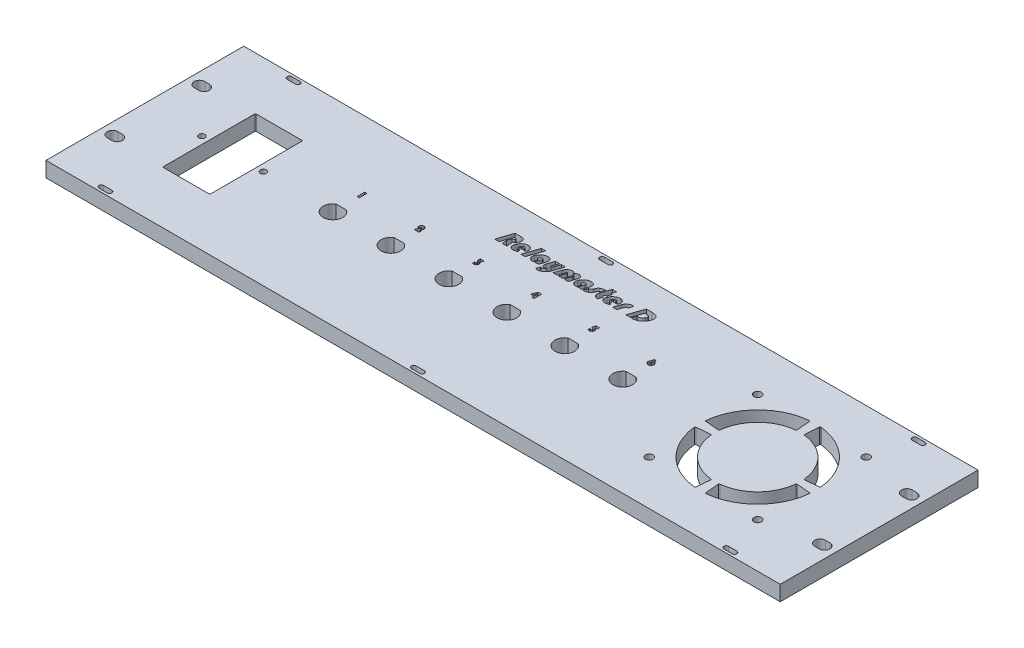
from build123d import *

# Parameters (mm, degrees)
SKETCH1_W           = 482.6
SKETCH1_H           = 130
BOSS_EXTRUDE1_DEPTH = 10
CUT_EXTRUDE2_DEPTH  = 407.159250458
SKETCH3_R           = 2
SKETCH3_W           = 31
SKETCH3_H           = 61
CUT_EXTRUDE3_DEPTH  = 407.159250576
FILLET1_R           = 0.5
SKETCH4_R           = 2.5
CUT_EXTRUDE4_DEPTH  = 407.159250576
FILLET2_R           = 0.5
CUT_EXTRUDE5_DEPTH  = 10
LPATTERN1_COUNT     = 6
LPATTERN1_PITCH     = 38.1
SKETCH6_W           = 1.458333334
SKETCH6_H           = 5
CUT_EXTRUDE6_DEPTH  = 407.159250576
CUT_EXTRUDE7_DEPTH  = 407.159250576
LPATTERN2_COUNT     = 2
LPATTERN2_PITCH     = 205.4
LPATTERN3_COUNT     = 2
LPATTERN3_PITCH     = 205.4


with BuildPart() as part:
    # Sketch1 → Boss-Extrude1 (new body)
    with BuildSketch(Plane(origin=(0, 0, 0), x_dir=(1, 0, 0), z_dir=(0, 1, 0))):
        with Locations((158.999180011, 3.013992786)):
            Rectangle(SKETCH1_W, SKETCH1_H)
        with BuildLine():
            Line((-75.000819989, 35.088992786), (-72.000819989, 35.088992786))
            ThreePointArc((-72.000819989, 35.088992786), (-68.500819989, 31.588992786), (-72.000819989, 28.088992786))
            Line((-72.000819989, 28.088992786), (-75.000819989, 28.088992786))
            ThreePointArc((-75.000819989, 28.088992786), (-78.500819989, 31.588992786), (-75.000819989, 35.088992786))
        make_face(mode=Mode.SUBTRACT)
        with BuildLine():
            Line((-75.000819989, -22.061007214), (-72.000819989, -22.061007214))
            ThreePointArc((-72.000819989, -22.061007214), (-68.500819989, -25.561007214), (-72.000819989, -29.061007214))
            Line((-72.000819989, -29.061007214), (-75.000819989, -29.061007214))
            ThreePointArc((-75.000819989, -29.061007214), (-78.500819989, -25.561007214), (-75.000819989, -22.061007214))
        make_face(mode=Mode.SUBTRACT)
        with BuildLine():
            Line((392.999180011, 28.088992786), (389.999180011, 28.088992786))
            ThreePointArc((389.999180011, 28.088992786), (386.499180011, 31.588992786), (389.999180011, 35.088992786))
            Line((389.999180011, 35.088992786), (392.999180011, 35.088992786))
            ThreePointArc((392.999180011, 35.088992786), (396.499180011, 31.588992786), (392.999180011, 28.088992786))
        make_face(mode=Mode.SUBTRACT)
        with BuildLine():
            Line((392.999180011, -29.061007214), (389.999180011, -29.061007214))
            ThreePointArc((389.999180011, -29.061007214), (386.499180011, -25.561007214), (389.999180011, -22.061007214))
            Line((389.999180011, -22.061007214), (392.999180011, -22.061007214))
            ThreePointArc((392.999180011, -22.061007214), (396.499180011, -25.561007214), (392.999180011, -29.061007214))
        make_face(mode=Mode.SUBTRACT)
    extrude(amount=BOSS_EXTRUDE1_DEPTH)

    # Sketch2 → Cut-Extrude2 (cut, through all)
    with BuildSketch(Plane(origin=(0, 10, 0), x_dir=(1, 0, 0), z_dir=(0, 1, 0))):
        with BuildLine():
            Line((115.335548963, 47.892597993), (112.88112188, 40.670375771))
            Line((112.88112188, 40.670375771), (109.964455213, 40.670375771))
            Line((109.964455213, 40.670375771), (113.362892713, 50.670375771))
            Line((113.362892713, 50.670375771), (117.238760769, 50.670375771))
            add(Edge.make_bspline(
                [(117.238760769, 50.670375771), (117.378488132, 50.66829828), (117.647033186, 50.664305505), (118.032383194, 50.622395907), (118.384034766, 50.556106218), (118.703397593, 50.463941844), (118.989470951, 50.342718773), (119.24243641, 50.19399272), (119.463573048, 50.018796041), (119.582453092, 49.878197324), (119.641104519, 49.808830632)],
                knots=[0, 0, 0, 0, 1.268946959, 2.438816719, 3.516291673, 4.516504795, 5.452755853, 6.33073326, 7.176439771, 8, 8, 8, 8], degree=3))
            add(Edge.make_bspline(
                [(119.641104519, 49.808830632), (119.699587482, 49.728059333), (119.815497833, 49.567974599), (119.940169757, 49.297913336), (120.030331769, 49.014477201), (120.080789399, 48.714181217), (120.087163726, 48.398352863), (120.058501635, 48.067327276), (119.990585038, 47.719606274), (119.917613523, 47.487590833), (119.879819797, 47.367424382)],
                knots=[0, 0, 0, 0, 0.932249006, 1.847671586, 2.771408984, 3.712800187, 4.689011787, 5.722820456, 6.820593216, 8, 8, 8, 8], degree=3))
            add(Edge.make_bspline(
                [(119.879819797, 47.367424382), (119.833154617, 47.242640155), (119.73998991, 46.993514658), (119.553958798, 46.637392928), (119.334324356, 46.296255789), (119.079127949, 45.968930566), (118.78594183, 45.657949303), (118.458228568, 45.360912296), (118.093564888, 45.0791406), (117.831047228, 44.908966444), (117.696660074, 44.821851465)],
                knots=[0, 0, 0, 0, 0.933827764, 1.864340643, 2.811651759, 3.77699005, 4.771445029, 5.806065946, 6.876888697, 8, 8, 8, 8], degree=3))
            Line((117.696660074, 44.821851465), (118.000479519, 40.670375771))
            Line((118.000479519, 40.670375771), (114.879819797, 40.670375771))
            Line((114.879819797, 40.670375771), (114.539107991, 43.91473341))
            Line((114.539107991, 43.91473341), (115.42018438, 46.503709104))
            Line((115.42018438, 46.503709104), (115.65455938, 46.503709104))
            add(Edge.make_bspline(
                [(115.65455938, 46.503709104), (115.734971548, 46.505495396), (115.889388907, 46.508925654), (116.109255254, 46.54293042), (116.305300414, 46.602372599), (116.479184767, 46.681114562), (116.62723646, 46.787460897), (116.750966962, 46.916259013), (116.85384571, 47.067291832), (116.897440132, 47.182563833), (116.919750352, 47.241556327)],
                knots=[0, 0, 0, 0, 1.223524833, 2.349563247, 3.373699419, 4.334298088, 5.241868773, 6.129650763, 7.042815567, 8, 8, 8, 8], degree=3))
            add(Edge.make_bspline(
                [(116.919750352, 47.241556327), (116.934777382, 47.291682787), (116.96261298, 47.384535466), (116.951585407, 47.524880574), (116.89732647, 47.646143738), (116.792814469, 47.740167427), (116.648948346, 47.811035287), (116.462837151, 47.857858322), (116.235649041, 47.887282053), (116.069892532, 47.890729859), (115.980080213, 47.892597993)],
                knots=[0, 0, 0, 0, 0.898624187, 1.664583208, 2.38131814, 3.142559736, 4.043707542, 5.133639638, 6.446911837, 8, 8, 8, 8], degree=3))
            Line((115.980080213, 47.892597993), (115.335548963, 47.892597993))
        make_face()
        with BuildLine():
            Line((127.08034063, 43.864820215), (122.928864935, 43.864820215))
            add(Edge.make_bspline(
                [(122.928864935, 43.864820215), (122.941416881, 43.962312226), (122.965754006, 44.151340708), (123.019854456, 44.334063129), (123.046052435, 44.42254591)],
                knots=[0, 0, 0, 0, 1.031506037, 2, 2, 2, 2], degree=3))
            add(Edge.make_bspline(
                [(123.046052435, 44.42254591), (123.090855315, 44.540828871), (123.182631693, 44.783125392), (123.320526452, 45.002525583), (123.391104519, 45.114820215)],
                knots=[0, 0, 0, 0, 0.976348819, 2, 2, 2, 2], degree=3))
            Line((123.391104519, 45.114820215), (124.782163547, 45.114820215))
            add(Edge.make_bspline(
                [(124.782163547, 45.114820215), (124.794125549, 45.190555028), (124.816364301, 45.331354834), (124.820854111, 45.531171801), (124.793971278, 45.701662984), (124.738371102, 45.844500806), (124.64770514, 45.956620204), (124.524334681, 46.034533211), (124.372169651, 46.079911288), (124.261662272, 46.084562352), (124.202736463, 46.087042438)],
                knots=[0, 0, 0, 0, 1.359693728, 2.52782843, 3.530177573, 4.404996503, 5.216909677, 6.042905647, 6.95641929, 8, 8, 8, 8], degree=3))
            add(Edge.make_bspline(
                [(124.202736463, 46.087042438), (124.118193946, 46.08130003), (123.946617115, 46.069645964), (123.694243041, 45.98197496), (123.450590766, 45.837939098), (123.215080686, 45.646292226), (122.997634436, 45.410280729), (122.806729307, 45.138945992), (122.641283655, 44.838221078), (122.560133535, 44.620494666), (122.518708685, 44.509351465)],
                knots=[0, 0, 0, 0, 0.827832751, 1.680064964, 2.58876647, 3.592266134, 4.646151931, 5.724523089, 6.838433137, 8, 8, 8, 8], degree=3))
            add(Edge.make_bspline(
                [(122.518708685, 44.509351465), (122.483339164, 44.39509878), (122.417212985, 44.18149415), (122.365590101, 43.868754192), (122.368927442, 43.589813158), (122.409068136, 43.379255472), (122.472460702, 43.236894832), (122.526284729, 43.143326768), (122.593203099, 43.065165826), (122.672675932, 43.002459843), (122.76097664, 42.95240462), (122.861064326, 42.91800648), (122.970519006, 42.895296046), (123.047374853, 42.893520178), (123.087285074, 42.892597993)],
                knots=[0, 0, 0, 0, 2.100659137, 3.927352035, 5.54202328, 6.985703129, 7.651739151, 8.273086743, 8.877024698, 9.446816915, 10.044433555, 10.651574031, 11.299780288, 12, 12, 12, 12], degree=3))
            add(Edge.make_bspline(
                [(123.087285074, 42.892597993), (123.157992575, 42.896846389), (123.305307183, 42.905697653), (123.527147225, 42.981170691), (123.761975886, 43.088670137), (123.912576788, 43.190369443), (123.992232991, 43.244160493)],
                knots=[0, 0, 0, 0, 0.859384503, 1.790473304, 2.831331656, 4, 4, 4, 4], degree=3))
            Line((123.992232991, 43.244160493), (124.918882297, 41.377841049))
            add(Edge.make_bspline(
                [(124.918882297, 41.377841049), (124.805303666, 41.310728523), (124.581406324, 41.178429727), (124.239470938, 41.005695243), (123.899490712, 40.858075685), (123.55930414, 40.741558557), (123.221125601, 40.647379427), (122.884034174, 40.579476505), (122.548630924, 40.539259758), (122.325670825, 40.534066996), (122.214889241, 40.531486882)],
                knots=[0, 0, 0, 0, 1.103083133, 2.174505721, 3.201645937, 4.200367129, 5.179341595, 6.135640026, 7.073660477, 8, 8, 8, 8], degree=3))
            add(Edge.make_bspline(
                [(122.214889241, 40.531486882), (122.08447934, 40.534542961), (121.831239059, 40.540477496), (121.46563732, 40.594130465), (121.126911628, 40.67645059), (120.81666703, 40.797954249), (120.532881795, 40.951084527), (120.278020994, 41.142371642), (120.053394583, 41.368839763), (119.856039792, 41.623968412), (119.693107858, 41.905425347), (119.571628364, 42.207548617), (119.487556662, 42.524586226), (119.448505815, 42.858099669), (119.442540147, 43.207624328), (119.485056147, 43.573147197), (119.562475159, 43.95478481), (119.643015599, 44.209077619), (119.684507297, 44.340080632)],
                knots=[0, 0, 0, 0, 1.131220035, 2.196692713, 3.200169955, 4.150382372, 5.080363814, 5.990725719, 6.905256434, 7.84081604, 8.783092785, 9.718125583, 10.65923029, 11.620967352, 12.625583103, 13.686384095, 14.808103719, 16, 16, 16, 16], degree=3))
            add(Edge.make_bspline(
                [(119.684507297, 44.340080632), (119.733155835, 44.472535163), (119.830125559, 44.736552946), (120.010903896, 45.11782135), (120.22536001, 45.480668303), (120.466831402, 45.828883941), (120.736861267, 46.162351996), (121.037639597, 46.479617852), (121.367860315, 46.781926048), (121.725988902, 47.062963718), (122.098942762, 47.320761063), (122.480157748, 47.54881461), (122.866600262, 47.739415146), (123.257139225, 47.897666728), (123.652283458, 48.019047922), (124.051420184, 48.106259338), (124.454426572, 48.160406735), (124.724851489, 48.167049081), (124.860288547, 48.170375771)],
                knots=[0, 0, 0, 0, 0.990392726, 1.974121168, 2.95757423, 3.946624651, 4.946878979, 5.967240611, 7.013379789, 8.087405977, 9.160939677, 10.194875671, 11.203387311, 12.183319209, 13.150466102, 14.101868051, 15.049357545, 16, 16, 16, 16], degree=3))
            add(Edge.make_bspline(
                [(124.860288547, 48.170375771), (124.989195588, 48.167003668), (125.23862877, 48.1604787), (125.599393998, 48.111487389), (125.931153197, 48.024075122), (126.236694853, 47.904867463), (126.513843985, 47.74969987), (126.765368016, 47.561719056), (126.985108142, 47.335554054), (127.175112098, 47.079561889), (127.334231451, 46.800275749), (127.453722842, 46.500766121), (127.535740598, 46.185138669), (127.572343683, 45.85303417), (127.575816123, 45.505771847), (127.533222764, 45.144147586), (127.458770539, 44.765643518), (127.378112369, 44.513715051), (127.336417019, 44.38348341)],
                knots=[0, 0, 0, 0, 1.131233226, 2.188919233, 3.186797597, 4.135858022, 5.059607904, 5.966224945, 6.882086875, 7.816638679, 8.757680654, 9.694945741, 10.638874518, 11.610640238, 12.620124796, 13.680208972, 14.800809634, 16, 16, 16, 16], degree=3))
            add(Edge.make_bspline(
                [(127.336417019, 44.38348341), (127.324471304, 44.352230352), (127.297152142, 44.280756408), (127.241258667, 44.163046447), (127.168061661, 44.021253826), (127.111065975, 43.919612967), (127.08034063, 43.864820215)],
                knots=[0, 0, 0, 0, 0.693176941, 1.585255743, 2.698254966, 4, 4, 4, 4], degree=3))
        make_face()
        Polygon((133.362892713, 50.670375771), (129.964455213, 40.670375771), (127.186677435, 40.670375771), (130.585114935, 50.670375771), align=None)
        with BuildLine():
            Line((136.457510769, 43.430792438), (135.487458685, 40.577059799))
            add(Edge.make_bspline(
                [(135.487458685, 40.577059799), (135.376921787, 40.563499792), (135.168596739, 40.537943718), (134.95877789, 40.533549525), (134.860288547, 40.531486882)],
                knots=[0, 0, 0, 0, 1.061196419, 2, 2, 2, 2], degree=3))
            add(Edge.make_bspline(
                [(134.860288547, 40.531486882), (134.727764931, 40.534833429), (134.471845778, 40.541296016), (134.101775461, 40.59043496), (133.761323697, 40.677711477), (133.448353472, 40.796934777), (133.162950569, 40.949536686), (132.906481501, 41.137322021), (132.68075858, 41.361871633), (132.486848438, 41.617307619), (132.325384425, 41.897723493), (132.203294986, 42.198508148), (132.122557852, 42.517663341), (132.08223896, 42.85300907), (132.080233177, 43.205447238), (132.121122706, 43.574076506), (132.201941594, 43.959771473), (132.283472842, 44.217743734), (132.325566324, 44.350931327)],
                knots=[0, 0, 0, 0, 1.144190407, 2.209570271, 3.21553817, 4.172569541, 5.094845463, 6.001870815, 6.907346212, 7.834348322, 8.763305581, 9.693584961, 10.628341389, 11.597586927, 12.603283284, 13.664902594, 14.794420756, 16, 16, 16, 16], degree=3))
            add(Edge.make_bspline(
                [(132.325566324, 44.350931327), (132.37398375, 44.482791321), (132.470273648, 44.745027187), (132.654095009, 45.121634423), (132.860458487, 45.486133354), (133.104678391, 45.831029956), (133.372661197, 46.163933582), (133.672890571, 46.479601096), (134.000019509, 46.78209882), (134.355989664, 47.062159765), (134.724998964, 47.321477753), (135.103475542, 47.548076548), (135.485817158, 47.739555998), (135.870951496, 47.896735612), (136.258486598, 48.019127059), (136.649023989, 48.106214447), (137.043366341, 48.160414346), (137.308035459, 48.167051724), (137.440583685, 48.170375771)],
                knots=[0, 0, 0, 0, 0.994917965, 1.97863784, 2.96618437, 3.960322707, 4.96997828, 5.992682734, 7.044876782, 8.124977746, 9.200176396, 10.239426291, 11.248235466, 12.227872304, 13.184528156, 14.124848425, 15.060910407, 16, 16, 16, 16], degree=3))
            add(Edge.make_bspline(
                [(137.440583685, 48.170375771), (137.583201753, 48.166841028), (137.857710374, 48.160037421), (138.252190324, 48.114078302), (138.61101029, 48.030477682), (138.937581704, 47.919787908), (139.2291217, 47.771177748), (139.485433798, 47.589607564), (139.709095397, 47.376806567), (139.892569309, 47.129765156), (140.042783005, 46.856699712), (140.147755803, 46.556447872), (140.216240252, 46.233436114), (140.240039977, 45.886931288), (140.225765332, 45.516894321), (140.172703802, 45.123891923), (140.078360059, 44.706527517), (139.987729028, 44.425502898), (139.940583685, 44.279316743)],
                knots=[0, 0, 0, 0, 1.196225853, 2.302473407, 3.323857472, 4.281343462, 5.187635444, 6.057979036, 6.907605345, 7.765509949, 8.628868004, 9.511642107, 10.423138458, 11.390568647, 12.416573448, 13.524350622, 14.712192315, 16, 16, 16, 16], degree=3))
            Line((139.940583685, 44.279316743), (138.714455213, 40.670375771))
            Line((138.714455213, 40.670375771), (135.936677435, 40.670375771))
            Line((135.936677435, 40.670375771), (137.095531602, 44.081834104))
            add(Edge.make_bspline(
                [(137.095531602, 44.081834104), (137.125372293, 44.175865751), (137.181071117, 44.35137952), (137.214182532, 44.608869329), (137.207476549, 44.837386602), (137.151188997, 45.034553405), (137.053506738, 45.19883364), (136.905887845, 45.31340088), (136.720887111, 45.38377354), (136.584807751, 45.389515743), (136.511764241, 45.392597993)],
                knots=[0, 0, 0, 0, 1.35465714, 2.52852086, 3.55473976, 4.477449583, 5.322396048, 6.136784919, 6.999879412, 8, 8, 8, 8], degree=3))
            add(Edge.make_bspline(
                [(136.511764241, 45.392597993), (136.440487272, 45.388725027), (136.295587453, 45.380851627), (136.080580816, 45.318593165), (135.867494597, 45.218862424), (135.662406979, 45.083372712), (135.471171907, 44.925914153), (135.313760861, 44.743956051), (135.183406645, 44.551882685), (135.128343188, 44.410058863), (135.101173963, 44.340080632)],
                knots=[0, 0, 0, 0, 0.917738553, 1.865681891, 2.862849718, 3.941460506, 5.026822724, 6.04444962, 7.03509894, 8, 8, 8, 8], degree=3))
            add(Edge.make_bspline(
                [(135.101173963, 44.340080632), (135.079429116, 44.269090589), (135.038522158, 44.135542317), (135.024703801, 43.936360387), (135.051527715, 43.755223054), (135.1245927, 43.597450478), (135.233579928, 43.464897699), (135.382697934, 43.375394635), (135.558300582, 43.316048654), (135.686559564, 43.311611255), (135.754385769, 43.30926466)],
                knots=[0, 0, 0, 0, 1.198022138, 2.253749655, 3.202377793, 4.129386931, 5.034563436, 5.934046712, 6.907477906, 8, 8, 8, 8], degree=3))
            add(Edge.make_bspline(
                [(135.754385769, 43.30926466), (135.873139025, 43.314497292), (136.112669262, 43.325051729), (136.34191798, 43.395347565), (136.457510769, 43.430792438)],
                knots=[0, 0, 0, 0, 0.991551279, 2, 2, 2, 2], degree=3))
        make_face()
        with BuildLine():
            Line((140.148917019, 37.532354938), (140.943187852, 39.869594521))
            add(Edge.make_bspline(
                [(140.943187852, 39.869594521), (141.02013581, 39.842699809), (141.169370442, 39.790539589), (141.393812069, 39.740560627), (141.607549569, 39.704647105), (141.747447398, 39.700280348), (141.815583685, 39.698153549)],
                knots=[0, 0, 0, 0, 1.094028368, 2.121783671, 3.0852275, 4, 4, 4, 4], degree=3))
            add(Edge.make_bspline(
                [(141.815583685, 39.698153549), (141.920143567, 39.701998741), (142.127157041, 39.709611665), (142.429761674, 39.780573707), (142.719904479, 39.891426296), (142.995136374, 40.05065303), (143.257970651, 40.253214536), (143.507164917, 40.499965332), (143.743703696, 40.791081659), (143.881619475, 41.008807831), (143.953170491, 41.12176466)],
                knots=[0, 0, 0, 0, 0.930598492, 1.842450686, 2.754758579, 3.690345955, 4.665181319, 5.704602894, 6.809142816, 8, 8, 8, 8], degree=3))
            add(Edge.make_bspline(
                [(143.953170491, 41.12176466), (143.814112857, 41.052953927), (143.549029445, 40.921781094), (143.149545971, 40.780536939), (142.77318422, 40.688423973), (142.527854899, 40.676225717), (142.410201741, 40.670375771)],
                knots=[0, 0, 0, 0, 1.146861305, 2.186243914, 3.130172742, 4, 4, 4, 4], degree=3))
            add(Edge.make_bspline(
                [(142.410201741, 40.670375771), (142.329806588, 40.673164719), (142.174025868, 40.678568831), (141.949637435, 40.711762823), (141.744805675, 40.773690165), (141.558672071, 40.858078556), (141.391462409, 40.967651362), (141.24461619, 41.102536624), (141.115161623, 41.259401746), (141.009579397, 41.44109676), (140.925549319, 41.640319772), (140.864200726, 41.854397294), (140.829559963, 42.08191437), (140.82295701, 42.321956916), (140.835065705, 42.574839567), (140.875593047, 42.840513324), (140.941108838, 43.11890367), (141.001173336, 43.306031987), (141.032163547, 43.402580632)],
                knots=[0, 0, 0, 0, 1.042971701, 2.020953713, 2.9322108, 3.809657486, 4.663202133, 5.513336514, 6.386710566, 7.291034154, 8.228574651, 9.184847823, 10.172102137, 11.204853161, 12.29467164, 13.451721446, 14.685218539, 16, 16, 16, 16], degree=3))
            Line((141.032163547, 43.402580632), (142.605514241, 48.031486882))
            Line((142.605514241, 48.031486882), (145.383292019, 48.031486882))
            Line((145.383292019, 48.031486882), (144.037805908, 44.073153549))
            add(Edge.make_bspline(
                [(144.037805908, 44.073153549), (144.023085095, 44.024955171), (143.995715082, 43.935341218), (143.971946886, 43.807975703), (143.971885102, 43.697374384), (143.997284272, 43.606051013), (144.045805577, 43.532456913), (144.118994198, 43.481030376), (144.214745234, 43.454216082), (144.284316705, 43.450287029), (144.322094102, 43.448153549)],
                knots=[0, 0, 0, 0, 1.413078495, 2.627299044, 3.621746679, 4.488562546, 5.2483103, 6.047925692, 6.940021184, 8, 8, 8, 8], degree=3))
            add(Edge.make_bspline(
                [(144.322094102, 43.448153549), (144.360668855, 43.450185893), (144.437069265, 43.454211114), (144.547256367, 43.488141488), (144.649092369, 43.543444552), (144.741541776, 43.621917787), (144.825589764, 43.720977848), (144.905177991, 43.839562972), (144.973493018, 43.982022227), (145.011654827, 44.085823883), (145.031729519, 44.140427854)],
                knots=[0, 0, 0, 0, 0.869551351, 1.722216603, 2.577381428, 3.470395431, 4.443063541, 5.50314562, 6.686551159, 8, 8, 8, 8], degree=3))
            Line((145.031729519, 44.140427854), (146.355514241, 48.031486882))
            Line((146.355514241, 48.031486882), (149.133292019, 48.031486882))
            Line((149.133292019, 48.031486882), (146.900219102, 41.460306327))
            add(Edge.make_bspline(
                [(146.900219102, 41.460306327), (146.846529409, 41.311936515), (146.740386668, 41.018614318), (146.547795979, 40.597051292), (146.333065007, 40.196534284), (146.093825937, 39.817893627), (145.830621309, 39.461002214), (145.54326396, 39.125383146), (145.230975839, 38.812174936), (145.005642705, 38.621653727), (144.89284063, 38.526278549)],
                knots=[0, 0, 0, 0, 1.050650266, 2.077100728, 3.083876355, 4.075771418, 5.057798155, 6.035120644, 7.016378708, 8, 8, 8, 8], degree=3))
            add(Edge.make_bspline(
                [(144.89284063, 38.526278549), (144.756023408, 38.420985437), (144.487833728, 38.214589449), (144.070813609, 37.94257526), (143.650947944, 37.714229619), (143.230002064, 37.525099336), (142.80635298, 37.379740057), (142.381812032, 37.274214479), (141.954882562, 37.211762244), (141.669658829, 37.202691726), (141.526955213, 37.198153549)],
                knots=[0, 0, 0, 0, 1.122840013, 2.200995601, 3.234956063, 4.229293297, 5.199609475, 6.14466215, 7.071734257, 8, 8, 8, 8], degree=3))
            add(Edge.make_bspline(
                [(141.526955213, 37.198153549), (141.404412037, 37.202354085), (141.162029915, 37.210662461), (140.807283842, 37.27584816), (140.46643697, 37.378300971), (140.254799821, 37.480982841), (140.148917019, 37.532354938)],
                knots=[0, 0, 0, 0, 1.026692551, 2.030728491, 3.014766614, 4, 4, 4, 4], degree=3))
        make_face()
        with BuildLine():
            Line((158.297788547, 40.670375771), (155.520010769, 40.670375771))
            Line((155.520010769, 40.670375771), (156.869837158, 44.643900077))
            add(Edge.make_bspline(
                [(156.869837158, 44.643900077), (156.890752793, 44.708769434), (156.928568197, 44.826053033), (156.971008238, 44.988029589), (156.986266286, 45.118552681), (156.987100273, 45.221531964), (156.957608846, 45.301254065), (156.900486246, 45.358409996), (156.816409596, 45.387340907), (156.754284388, 45.390731943), (156.720097574, 45.392597993)],
                knots=[0, 0, 0, 0, 1.748842243, 3.161901443, 4.282714784, 5.118485949, 5.776578054, 6.406334469, 7.123023523, 8, 8, 8, 8], degree=3))
            add(Edge.make_bspline(
                [(156.720097574, 45.392597993), (156.68500871, 45.390869356), (156.614263068, 45.387384103), (156.513404847, 45.347036512), (156.417609843, 45.287734638), (156.330460985, 45.201368133), (156.245513054, 45.095059054), (156.168010544, 44.963119272), (156.096691639, 44.807830463), (156.055887586, 44.694882144), (156.034333685, 44.635219521)],
                knots=[0, 0, 0, 0, 0.76938146, 1.551215389, 2.360681049, 3.240269051, 4.238683293, 5.354204105, 6.602412819, 8, 8, 8, 8], degree=3))
            Line((156.034333685, 44.635219521), (154.686677435, 40.670375771))
            Line((154.686677435, 40.670375771), (151.908899658, 40.670375771))
            Line((151.908899658, 40.670375771), (153.258726047, 44.643900077))
            add(Edge.make_bspline(
                [(153.258726047, 44.643900077), (153.2796784, 44.708765445), (153.317560192, 44.826041834), (153.359602428, 44.988061599), (153.375928708, 45.11850903), (153.374078302, 45.22209764), (153.341830196, 45.300753889), (153.284744356, 45.35912794), (153.199274759, 45.386897435), (153.136596371, 45.390588618), (153.102476047, 45.392597993)],
                knots=[0, 0, 0, 0, 1.743312146, 3.151903045, 4.269172209, 5.103326437, 5.766340049, 6.394105081, 7.125796652, 8, 8, 8, 8], degree=3))
            add(Edge.make_bspline(
                [(153.102476047, 45.392597993), (153.068092396, 45.39088703), (152.998714867, 45.387434738), (152.899603438, 45.346471978), (152.804405201, 45.287722273), (152.717069853, 45.202007064), (152.634718732, 45.094249043), (152.556727428, 44.963253216), (152.485631828, 44.807790515), (152.444794207, 44.694868336), (152.423222574, 44.635219521)],
                knots=[0, 0, 0, 0, 0.757373858, 1.528189294, 2.341787876, 3.225866826, 4.219478986, 5.340695358, 6.595277101, 8, 8, 8, 8], degree=3))
            Line((152.423222574, 44.635219521), (151.075566324, 40.670375771))
            Line((151.075566324, 40.670375771), (148.297788547, 40.670375771))
            Line((148.297788547, 40.670375771), (149.838587158, 45.20379591))
            add(Edge.make_bspline(
                [(149.838587158, 45.20379591), (149.876187575, 45.305660073), (149.950891659, 45.508042644), (150.08881248, 45.800892687), (150.250104723, 46.081138394), (150.432530847, 46.349943218), (150.635346567, 46.608295007), (150.862133246, 46.853028773), (151.10927862, 47.088165482), (151.377168463, 47.306223136), (151.653295203, 47.510151264), (151.937658229, 47.685370439), (152.223356779, 47.834364279), (152.510134361, 47.955741882), (152.79829978, 48.05362416), (153.089356707, 48.119310981), (153.381793623, 48.163528461), (153.577576306, 48.168094499), (153.675392713, 48.170375771)],
                knots=[0, 0, 0, 0, 1.013103043, 2.012821709, 3.016908165, 4.028119661, 5.042504246, 6.07937814, 7.139618998, 8.223669354, 9.301330298, 10.341211316, 11.337733066, 12.305831584, 13.245253476, 14.173865134, 15.087631509, 16, 16, 16, 16], degree=3))
            add(Edge.make_bspline(
                [(153.675392713, 48.170375771), (153.773262472, 48.167794328), (153.964448152, 48.162751557), (154.242259093, 48.113502056), (154.502096264, 48.034557281), (154.741440971, 47.919186787), (154.963301984, 47.774935668), (155.166072403, 47.597335562), (155.350748671, 47.38753613), (155.452631544, 47.227861557), (155.504819797, 47.146070215)],
                knots=[0, 0, 0, 0, 1.065504291, 2.08143111, 3.063685821, 4.01558644, 4.966572901, 5.938655121, 6.944101375, 8, 8, 8, 8], degree=3))
            add(Edge.make_bspline(
                [(155.504819797, 47.146070215), (155.620345523, 47.227780554), (155.844584869, 47.386383086), (156.185446942, 47.593366669), (156.513889557, 47.772035551), (156.833060336, 47.914434985), (157.139665376, 48.029759637), (157.436630561, 48.110748498), (157.723127157, 48.161282153), (157.911315402, 48.167404422), (158.002649658, 48.170375771)],
                knots=[0, 0, 0, 0, 1.238368342, 2.403714859, 3.488821346, 4.509228997, 5.460906033, 6.353438097, 7.200866636, 8, 8, 8, 8], degree=3))
            add(Edge.make_bspline(
                [(158.002649658, 48.170375771), (158.112062139, 48.16784948), (158.323336382, 48.16297124), (158.625818495, 48.114886739), (158.901271553, 48.036160059), (159.150999547, 47.9294907), (159.371021983, 47.785234715), (159.564762198, 47.612307366), (159.730132127, 47.406112529), (159.813523843, 47.249577073), (159.855948269, 47.169941743)],
                knots=[0, 0, 0, 0, 1.175481199, 2.26984069, 3.281386599, 4.249402272, 5.17686982, 6.096480107, 7.031609587, 8, 8, 8, 8], degree=3))
            add(Edge.make_bspline(
                [(159.855948269, 47.169941743), (159.885655299, 47.101982992), (159.946982723, 46.961688415), (159.997987703, 46.729515598), (160.024336671, 46.476918113), (160.019615026, 46.20212753), (159.992444823, 45.904898604), (159.930210086, 45.586605716), (159.846920743, 45.245468893), (159.771455358, 45.013813362), (159.732250352, 44.893466049)],
                knots=[0, 0, 0, 0, 0.760994326, 1.571002632, 2.430962691, 3.368121175, 4.391640095, 5.495931954, 6.699112165, 8, 8, 8, 8], degree=3))
            Line((159.732250352, 44.893466049), (158.297788547, 40.670375771))
        make_face()
        with BuildLine():
            Line((164.929732991, 43.430792438), (163.959680908, 40.577059799))
            add(Edge.make_bspline(
                [(163.959680908, 40.577059799), (163.84914401, 40.563499792), (163.640818961, 40.537943718), (163.431000112, 40.533549525), (163.332510769, 40.531486882)],
                knots=[0, 0, 0, 0, 1.061196419, 2, 2, 2, 2], degree=3))
            add(Edge.make_bspline(
                [(163.332510769, 40.531486882), (163.199987154, 40.534833429), (162.944068, 40.541296016), (162.573997683, 40.59043496), (162.233545919, 40.677711477), (161.920575694, 40.796934777), (161.635172791, 40.949536686), (161.378703723, 41.137322021), (161.152980803, 41.361871633), (160.95907066, 41.617307619), (160.797606647, 41.897723493), (160.675517209, 42.198508148), (160.594780074, 42.517663341), (160.554461182, 42.85300907), (160.5524554, 43.205447238), (160.593344928, 43.574076506), (160.674163816, 43.959771473), (160.755695064, 44.217743734), (160.797788547, 44.350931327)],
                knots=[0, 0, 0, 0, 1.144190407, 2.209570271, 3.21553817, 4.172569541, 5.094845463, 6.001870815, 6.907346212, 7.834348322, 8.763305581, 9.693584961, 10.628341389, 11.597586927, 12.603283284, 13.664902594, 14.794420756, 16, 16, 16, 16], degree=3))
            add(Edge.make_bspline(
                [(160.797788547, 44.350931327), (160.846205972, 44.482791321), (160.942495871, 44.745027187), (161.126317231, 45.121634423), (161.332680709, 45.486133354), (161.576900613, 45.831029956), (161.844883419, 46.163933582), (162.145112793, 46.479601096), (162.472241731, 46.78209882), (162.828211886, 47.062159765), (163.197221187, 47.321477753), (163.575697764, 47.548076548), (163.958039381, 47.739555998), (164.343173718, 47.896735612), (164.73070882, 48.019127059), (165.121246212, 48.106214447), (165.515588563, 48.160414346), (165.780257682, 48.167051724), (165.912805908, 48.170375771)],
                knots=[0, 0, 0, 0, 0.994917965, 1.97863784, 2.96618437, 3.960322707, 4.96997828, 5.992682734, 7.044876782, 8.124977746, 9.200176396, 10.239426291, 11.248235466, 12.227872304, 13.184528156, 14.124848425, 15.060910407, 16, 16, 16, 16], degree=3))
            add(Edge.make_bspline(
                [(165.912805908, 48.170375771), (166.055423975, 48.166841028), (166.329932596, 48.160037421), (166.724412546, 48.114078302), (167.083232512, 48.030477682), (167.409803926, 47.919787908), (167.701343922, 47.771177748), (167.95765602, 47.589607564), (168.181317619, 47.376806567), (168.364791532, 47.129765156), (168.515005228, 46.856699712), (168.619978025, 46.556447872), (168.688462474, 46.233436114), (168.712262199, 45.886931288), (168.697987554, 45.516894321), (168.644926024, 45.123891923), (168.550582281, 44.706527517), (168.45995125, 44.425502898), (168.412805908, 44.279316743)],
                knots=[0, 0, 0, 0, 1.196225853, 2.302473407, 3.323857472, 4.281343462, 5.187635444, 6.057979036, 6.907605345, 7.765509949, 8.628868004, 9.511642107, 10.423138458, 11.390568647, 12.416573448, 13.524350622, 14.712192315, 16, 16, 16, 16], degree=3))
            Line((168.412805908, 44.279316743), (167.186677435, 40.670375771))
            Line((167.186677435, 40.670375771), (164.408899658, 40.670375771))
            Line((164.408899658, 40.670375771), (165.567753824, 44.081834104))
            add(Edge.make_bspline(
                [(165.567753824, 44.081834104), (165.597594515, 44.175865751), (165.653293339, 44.35137952), (165.686404754, 44.608869329), (165.679698771, 44.837386602), (165.623411219, 45.034553405), (165.52572896, 45.19883364), (165.378110067, 45.31340088), (165.193109333, 45.38377354), (165.057029973, 45.389515743), (164.983986463, 45.392597993)],
                knots=[0, 0, 0, 0, 1.35465714, 2.52852086, 3.55473976, 4.477449583, 5.322396048, 6.136784919, 6.999879412, 8, 8, 8, 8], degree=3))
            add(Edge.make_bspline(
                [(164.983986463, 45.392597993), (164.912709494, 45.388725027), (164.767809675, 45.380851627), (164.552803038, 45.318593165), (164.339716819, 45.218862424), (164.134629201, 45.083372712), (163.943394129, 44.925914153), (163.785983084, 44.743956051), (163.655628867, 44.551882685), (163.60056541, 44.410058863), (163.573396185, 44.340080632)],
                knots=[0, 0, 0, 0, 0.917738553, 1.865681891, 2.862849718, 3.941460506, 5.026822724, 6.04444962, 7.03509894, 8, 8, 8, 8], degree=3))
            add(Edge.make_bspline(
                [(163.573396185, 44.340080632), (163.551651338, 44.269090589), (163.51074438, 44.135542317), (163.496926023, 43.936360387), (163.523749937, 43.755223054), (163.596814922, 43.597450478), (163.70580215, 43.464897699), (163.854920156, 43.375394635), (164.030522804, 43.316048654), (164.158781786, 43.311611255), (164.226607991, 43.30926466)],
                knots=[0, 0, 0, 0, 1.198022138, 2.253749655, 3.202377793, 4.129386931, 5.034563436, 5.934046712, 6.907477906, 8, 8, 8, 8], degree=3))
            add(Edge.make_bspline(
                [(164.226607991, 43.30926466), (164.345361247, 43.314497292), (164.584891484, 43.325051729), (164.814140203, 43.395347565), (164.929732991, 43.430792438)],
                knots=[0, 0, 0, 0, 0.991551279, 2, 2, 2, 2], degree=3))
        make_face()
        with BuildLine():
            Line((175.75221563, 47.892597993), (174.782163547, 45.041035493))
            add(Edge.make_bspline(
                [(174.782163547, 45.041035493), (174.691535454, 45.039163626), (174.521493623, 45.035651517), (174.284215281, 44.993839664), (174.08079003, 44.929202488), (173.90718541, 44.828740709), (173.757928172, 44.683926678), (173.618306368, 44.493091232), (173.476623556, 44.252719279), (173.39426509, 44.069770727), (173.34987188, 43.971157021)],
                knots=[0, 0, 0, 0, 1.119399073, 2.100283277, 2.968675404, 3.746469813, 4.556464414, 5.520730625, 6.663613678, 8, 8, 8, 8], degree=3))
            add(Edge.make_bspline(
                [(173.34987188, 43.971157021), (173.272338497, 43.799782325), (173.120651822, 43.464504061), (172.850517133, 42.994008614), (172.558365061, 42.560316919), (172.238329253, 42.16575805), (171.892302584, 41.809908376), (171.518406343, 41.493815724), (171.120291732, 41.213172039), (170.834239401, 41.061003369), (170.691451741, 40.98504591)],
                knots=[0, 0, 0, 0, 1.105028626, 2.161883212, 3.18431722, 4.175727407, 5.143889537, 6.097148449, 7.050160794, 8, 8, 8, 8], degree=3))
            add(Edge.make_bspline(
                [(170.691451741, 40.98504591), (170.612419832, 40.94830257), (170.451803003, 40.87362895), (170.196226056, 40.78412119), (169.926746721, 40.705836468), (169.642119403, 40.640585584), (169.342069444, 40.590854573), (169.026114501, 40.557212416), (168.695258752, 40.534447755), (168.469269456, 40.532485778), (168.354212158, 40.531486882)],
                knots=[0, 0, 0, 0, 0.870732372, 1.769592501, 2.70323275, 3.674987363, 4.686600388, 5.741428585, 6.850099853, 8, 8, 8, 8], degree=3))
            Line((168.354212158, 40.531486882), (167.972267713, 40.531486882))
            Line((167.972267713, 40.531486882), (168.964021185, 43.448153549))
            Line((168.964021185, 43.448153549), (169.087719102, 43.448153549))
            add(Edge.make_bspline(
                [(169.087719102, 43.448153549), (169.192109346, 43.451269202), (169.389919548, 43.457173086), (169.669442979, 43.506783308), (169.914356329, 43.589814943), (170.127168872, 43.714319749), (170.315413135, 43.881696242), (170.484329628, 44.098969213), (170.640104085, 44.366340995), (170.727564856, 44.566194304), (170.773917019, 44.672111882)],
                knots=[0, 0, 0, 0, 1.11106814, 2.105375046, 3.011751154, 3.850766066, 4.713186862, 5.678110215, 6.769452727, 8, 8, 8, 8], degree=3))
            add(Edge.make_bspline(
                [(170.773917019, 44.672111882), (170.809033582, 44.761222305), (170.876610103, 44.932701854), (170.979523071, 45.178286022), (171.075465067, 45.404406064), (171.172697599, 45.607684349), (171.260088834, 45.793697124), (171.347467334, 45.956932051), (171.426440027, 46.101905623), (171.533339373, 46.267297491), (171.682608451, 46.461445128), (171.894541227, 46.684001071), (172.143517034, 46.906796603), (172.328760499, 47.045502505), (172.425392713, 47.11785841)],
                knots=[0, 0, 0, 0, 1.146771218, 2.206787996, 3.188276572, 4.087223389, 4.904609345, 5.648478036, 6.303828441, 6.88044313, 8.004752368, 9.230203983, 10.555136488, 12, 12, 12, 12], degree=3))
            add(Edge.make_bspline(
                [(172.425392713, 47.11785841), (172.515491389, 47.18029104), (172.694007174, 47.303991081), (172.979926968, 47.459869577), (173.274774202, 47.596235537), (173.583527149, 47.7033242), (173.902518785, 47.788956467), (174.232624665, 47.849772102), (174.574545029, 47.884171801), (174.80596044, 47.889764219), (174.923222574, 47.892597993)],
                knots=[0, 0, 0, 0, 0.98842492, 1.958402261, 2.933985441, 3.916617661, 4.902993091, 5.911810608, 6.941878838, 8, 8, 8, 8], degree=3))
            Line((174.923222574, 47.892597993), (175.75221563, 47.892597993))
        make_face()
        with BuildLine():
            Line((180.02955938, 50.670375771), (179.085548963, 47.892597993))
            Line((179.085548963, 47.892597993), (180.196660074, 47.892597993))
            Line((180.196660074, 47.892597993), (179.204906602, 44.975931327))
            Line((179.204906602, 44.975931327), (178.093795491, 44.975931327))
            add(Edge.make_bspline(
                [(178.093795491, 44.975931327), (178.070694343, 44.905968736), (178.026901033, 44.773339253), (177.974710993, 44.580538993), (177.934486694, 44.405594132), (177.910371813, 44.245943836), (177.898974137, 44.103754706), (177.899721558, 43.977790681), (177.915878377, 43.868250337), (177.949171142, 43.77403808), (177.997287566, 43.692711593), (178.066616962, 43.626890732), (178.148519467, 43.566905923), (178.251452347, 43.523164458), (178.369356661, 43.484495265), (178.506449807, 43.464558707), (178.658900726, 43.44432316), (178.766447341, 43.443988914), (178.822962158, 43.443813271)],
                knots=[0, 0, 0, 0, 1.598754782, 3.03079146, 4.333491572, 5.492511037, 6.531663101, 7.426686025, 8.221657396, 8.921837668, 9.584210452, 10.250294036, 10.982144482, 11.776029931, 12.664834944, 13.668882151, 14.775017738, 16, 16, 16, 16], degree=3))
            Line((178.822962158, 43.443813271), (177.846399658, 40.570549382))
            add(Edge.make_bspline(
                [(177.846399658, 40.570549382), (177.811748747, 40.564233066), (177.746979638, 40.552426676), (177.656804338, 40.543812369), (177.582616715, 40.532611735), (177.538269922, 40.531831182), (177.518708685, 40.531486882)],
                knots=[0, 0, 0, 0, 1.278800772, 2.390320591, 3.289975278, 4, 4, 4, 4], degree=3))
            add(Edge.make_bspline(
                [(177.518708685, 40.531486882), (177.441959676, 40.532416986), (177.291033471, 40.534246028), (177.06956434, 40.558170063), (176.855880726, 40.588614478), (176.651059476, 40.637836266), (176.452485763, 40.697696859), (176.263081912, 40.774099697), (176.080208874, 40.861012034), (175.90827083, 40.963145515), (175.745112255, 41.074554579), (175.596809516, 41.200249982), (175.460085516, 41.333535655), (175.338105488, 41.477989264), (175.229312972, 41.630425827), (175.132540679, 41.791481794), (175.052356464, 41.964572328), (175.008442515, 42.084969693), (174.986156602, 42.146070215)],
                knots=[0, 0, 0, 0, 1.14390857, 2.24948543, 3.31894963, 4.360354346, 5.387413571, 6.40901995, 7.40291345, 8.403807109, 9.388289641, 10.3454434, 11.298942958, 12.232649643, 13.160605769, 14.089313989, 15.030344949, 16, 16, 16, 16], degree=3))
            add(Edge.make_bspline(
                [(174.986156602, 42.146070215), (174.963433641, 42.228140378), (174.916697464, 42.396940816), (174.878680447, 42.665654969), (174.869199183, 42.953464617), (174.884923383, 43.259750201), (174.927690582, 43.585168802), (174.994596343, 43.929750045), (175.09213909, 44.293342785), (175.171018177, 44.540056681), (175.211851047, 44.667771604)],
                knots=[0, 0, 0, 0, 0.79382568, 1.632726416, 2.52416093, 3.476864566, 4.490526111, 5.583733703, 6.749185725, 8, 8, 8, 8], degree=3))
            Line((175.211851047, 44.667771604), (177.251781602, 50.670375771))
            Line((177.251781602, 50.670375771), (180.02955938, 50.670375771))
        make_face()
        with BuildLine():
            Line((187.358118408, 43.864820215), (183.206642713, 43.864820215))
            add(Edge.make_bspline(
                [(183.206642713, 43.864820215), (183.219194659, 43.962312226), (183.243531784, 44.151340708), (183.297632234, 44.334063129), (183.323830213, 44.42254591)],
                knots=[0, 0, 0, 0, 1.031506037, 2, 2, 2, 2], degree=3))
            add(Edge.make_bspline(
                [(183.323830213, 44.42254591), (183.368633093, 44.540828871), (183.460409471, 44.783125392), (183.59830423, 45.002525583), (183.668882297, 45.114820215)],
                knots=[0, 0, 0, 0, 0.976348819, 2, 2, 2, 2], degree=3))
            Line((183.668882297, 45.114820215), (185.059941324, 45.114820215))
            add(Edge.make_bspline(
                [(185.059941324, 45.114820215), (185.071903327, 45.190555028), (185.094142079, 45.331354834), (185.098631889, 45.531171801), (185.071749056, 45.701662984), (185.01614888, 45.844500806), (184.925482918, 45.956620204), (184.802112458, 46.034533211), (184.649947429, 46.079911288), (184.53944005, 46.084562352), (184.480514241, 46.087042438)],
                knots=[0, 0, 0, 0, 1.359693728, 2.52782843, 3.530177573, 4.404996503, 5.216909677, 6.042905647, 6.95641929, 8, 8, 8, 8], degree=3))
            add(Edge.make_bspline(
                [(184.480514241, 46.087042438), (184.395971724, 46.08130003), (184.224394893, 46.069645964), (183.972020819, 45.98197496), (183.728368544, 45.837939098), (183.492858464, 45.646292226), (183.275412214, 45.410280729), (183.084507085, 45.138945992), (182.919061433, 44.838221078), (182.837911313, 44.620494666), (182.796486463, 44.509351465)],
                knots=[0, 0, 0, 0, 0.827832751, 1.680064964, 2.58876647, 3.592266134, 4.646151931, 5.724523089, 6.838433137, 8, 8, 8, 8], degree=3))
            add(Edge.make_bspline(
                [(182.796486463, 44.509351465), (182.761116942, 44.39509878), (182.694990763, 44.18149415), (182.643367879, 43.868754192), (182.646705219, 43.589813158), (182.686845914, 43.379255472), (182.75023848, 43.236894832), (182.804062507, 43.143326768), (182.870980876, 43.065165826), (182.95045371, 43.002459843), (183.038754418, 42.95240462), (183.138842103, 42.91800648), (183.248296784, 42.895296046), (183.325152631, 42.893520178), (183.365062852, 42.892597993)],
                knots=[0, 0, 0, 0, 2.100659137, 3.927352035, 5.54202328, 6.985703129, 7.651739151, 8.273086743, 8.877024698, 9.446816915, 10.044433555, 10.651574031, 11.299780288, 12, 12, 12, 12], degree=3))
            add(Edge.make_bspline(
                [(183.365062852, 42.892597993), (183.435770352, 42.896846389), (183.583084961, 42.905697653), (183.804925003, 42.981170691), (184.039753664, 43.088670137), (184.190354566, 43.190369443), (184.270010769, 43.244160493)],
                knots=[0, 0, 0, 0, 0.859384503, 1.790473304, 2.831331656, 4, 4, 4, 4], degree=3))
            Line((184.270010769, 43.244160493), (185.196660074, 41.377841049))
            add(Edge.make_bspline(
                [(185.196660074, 41.377841049), (185.083081444, 41.310728523), (184.859184102, 41.178429727), (184.517248716, 41.005695243), (184.17726849, 40.858075685), (183.837081918, 40.741558557), (183.498903379, 40.647379427), (183.161811952, 40.579476505), (182.826408702, 40.539259758), (182.603448603, 40.534066996), (182.492667019, 40.531486882)],
                knots=[0, 0, 0, 0, 1.103083133, 2.174505721, 3.201645937, 4.200367129, 5.179341595, 6.135640026, 7.073660477, 8, 8, 8, 8], degree=3))
            add(Edge.make_bspline(
                [(182.492667019, 40.531486882), (182.362257118, 40.534542961), (182.109016836, 40.540477496), (181.743415098, 40.594130465), (181.404689406, 40.67645059), (181.094444808, 40.797954249), (180.810659573, 40.951084527), (180.555798771, 41.142371642), (180.331172361, 41.368839763), (180.13381757, 41.623968412), (179.970885636, 41.905425347), (179.849406142, 42.207548617), (179.765334439, 42.524586226), (179.726283593, 42.858099669), (179.720317925, 43.207624328), (179.762833925, 43.573147197), (179.840252937, 43.95478481), (179.920793377, 44.209077619), (179.962285074, 44.340080632)],
                knots=[0, 0, 0, 0, 1.131220035, 2.196692713, 3.200169955, 4.150382372, 5.080363814, 5.990725719, 6.905256434, 7.84081604, 8.783092785, 9.718125583, 10.65923029, 11.620967352, 12.625583103, 13.686384095, 14.808103719, 16, 16, 16, 16], degree=3))
            add(Edge.make_bspline(
                [(179.962285074, 44.340080632), (180.010933613, 44.472535163), (180.107903337, 44.736552946), (180.288681674, 45.11782135), (180.503137788, 45.480668303), (180.74460918, 45.828883941), (181.014639045, 46.162351996), (181.315417375, 46.479617852), (181.645638093, 46.781926048), (182.00376668, 47.062963718), (182.37672054, 47.320761063), (182.757935525, 47.54881461), (183.14437804, 47.739415146), (183.534917002, 47.897666728), (183.930061236, 48.019047922), (184.329197962, 48.106259338), (184.73220435, 48.160406735), (185.002629267, 48.167049081), (185.138066324, 48.170375771)],
                knots=[0, 0, 0, 0, 0.990392726, 1.974121168, 2.95757423, 3.946624651, 4.946878979, 5.967240611, 7.013379789, 8.087405977, 9.160939677, 10.194875671, 11.203387311, 12.183319209, 13.150466102, 14.101868051, 15.049357545, 16, 16, 16, 16], degree=3))
            add(Edge.make_bspline(
                [(185.138066324, 48.170375771), (185.266973366, 48.167003668), (185.516406548, 48.1604787), (185.877171775, 48.111487389), (186.208930975, 48.024075122), (186.514472631, 47.904867463), (186.791621763, 47.74969987), (187.043145793, 47.561719056), (187.26288592, 47.335554054), (187.452889876, 47.079561889), (187.612009229, 46.800275749), (187.73150062, 46.500766121), (187.813518376, 46.185138669), (187.850121461, 45.85303417), (187.8535939, 45.505771847), (187.811000542, 45.144147586), (187.736548317, 44.765643518), (187.655890147, 44.513715051), (187.614194797, 44.38348341)],
                knots=[0, 0, 0, 0, 1.131233226, 2.188919233, 3.186797597, 4.135858022, 5.059607904, 5.966224945, 6.882086875, 7.816638679, 8.757680654, 9.694945741, 10.638874518, 11.610640238, 12.620124796, 13.680208972, 14.800809634, 16, 16, 16, 16], degree=3))
            add(Edge.make_bspline(
                [(187.614194797, 44.38348341), (187.602249082, 44.352230352), (187.57492992, 44.280756408), (187.519036445, 44.163046447), (187.445839438, 44.021253826), (187.388843753, 43.919612967), (187.358118408, 43.864820215)],
                knots=[0, 0, 0, 0, 0.693176941, 1.585255743, 2.698254966, 4, 4, 4, 4], degree=3))
        make_face()
        with BuildLine():
            Line((194.018274658, 48.103101465), (193.015670491, 45.151712577))
            add(Edge.make_bspline(
                [(193.015670491, 45.151712577), (192.935520246, 45.181170048), (192.781146432, 45.237906771), (192.617109548, 45.248578225), (192.538239935, 45.253709104)],
                knots=[0, 0, 0, 0, 1.038391726, 2, 2, 2, 2], degree=3))
            add(Edge.make_bspline(
                [(192.538239935, 45.253709104), (192.47859597, 45.250259929), (192.360775905, 45.243446464), (192.189091856, 45.1919662), (192.031323288, 45.102177424), (191.884470037, 44.981117653), (191.750202331, 44.825311891), (191.630667557, 44.634695622), (191.5184537, 44.412150904), (191.46001019, 44.248254471), (191.429298963, 44.162129243)],
                knots=[0, 0, 0, 0, 0.857727879, 1.694346698, 2.551821821, 3.454253235, 4.420876919, 5.498016402, 6.685243464, 8, 8, 8, 8], degree=3))
            Line((191.429298963, 44.162129243), (190.242232991, 40.670375771))
            Line((190.242232991, 40.670375771), (187.464455213, 40.670375771))
            Line((187.464455213, 40.670375771), (188.831642713, 44.693813271))
            add(Edge.make_bspline(
                [(188.831642713, 44.693813271), (188.878462324, 44.823221735), (188.970897882, 45.078711764), (189.136622647, 45.446573119), (189.323683505, 45.794207419), (189.529512415, 46.12252589), (189.756186845, 46.430451469), (190.004416726, 46.716942828), (190.271219621, 46.98479767), (190.557738097, 47.229187571), (190.857199926, 47.450360788), (191.168788649, 47.640953269), (191.486745423, 47.806450823), (191.815243835, 47.937576073), (192.150088804, 48.043104486), (192.493627518, 48.117182704), (192.845248993, 48.16112839), (193.082821956, 48.167281328), (193.202302435, 48.170375771)],
                knots=[0, 0, 0, 0, 1.106368822, 2.184294552, 3.240961959, 4.278726181, 5.297917302, 6.312499573, 7.324376687, 8.335166364, 9.338091685, 10.314830193, 11.269634832, 12.216985574, 13.155327909, 14.089785499, 15.039312627, 16, 16, 16, 16], degree=3))
            add(Edge.make_bspline(
                [(193.202302435, 48.170375771), (193.259472758, 48.169459153), (193.381897494, 48.167496305), (193.575010376, 48.152857634), (193.790198982, 48.134508636), (193.939505908, 48.113948319), (194.018274658, 48.103101465)],
                knots=[0, 0, 0, 0, 0.837281348, 1.792957316, 2.835646834, 4, 4, 4, 4], degree=3))
        make_face()
        with BuildLine():
            Line((201.537805908, 47.753709104), (199.13112188, 40.670375771))
            Line((199.13112188, 40.670375771), (196.214455213, 40.670375771))
            Line((196.214455213, 40.670375771), (199.612892713, 50.670375771))
            Line((199.612892713, 50.670375771), (203.501781602, 50.670375771))
            add(Edge.make_bspline(
                [(203.501781602, 50.670375771), (203.705890883, 50.667410072), (204.099698129, 50.66168807), (204.667195111, 50.607860531), (205.187774709, 50.516287195), (205.664026156, 50.396270909), (206.092246352, 50.232177466), (206.475366821, 50.035388097), (206.813400762, 49.801083692), (207.002543988, 49.612778014), (207.095531602, 49.52020216)],
                knots=[0, 0, 0, 0, 1.262400789, 2.435668661, 3.521533576, 4.529833824, 5.468912648, 6.351548883, 7.189579565, 8, 8, 8, 8], degree=3))
            add(Edge.make_bspline(
                [(207.095531602, 49.52020216), (207.145835013, 49.462489623), (207.245625682, 49.348000911), (207.374693287, 49.161956126), (207.491165381, 48.970458029), (207.590378416, 48.77047146), (207.67622543, 48.56363855), (207.743390408, 48.348561153), (207.792315173, 48.125362187), (207.830242142, 47.895911629), (207.849722856, 47.657867941), (207.850161745, 47.41216555), (207.840585242, 47.158469331), (207.812049342, 46.897463759), (207.764406092, 46.630110705), (207.70772669, 46.35326118), (207.62791163, 46.070320427), (207.567019579, 45.879971967), (207.536069797, 45.783222993)],
                knots=[0, 0, 0, 0, 0.92729224, 1.839539534, 2.740252885, 3.642117744, 4.542532316, 5.45212116, 6.368907862, 7.310188441, 8.269148525, 9.259966963, 10.286754772, 11.345066242, 12.43913077, 13.577548513, 14.768733435, 16, 16, 16, 16], degree=3))
            add(Edge.make_bspline(
                [(207.536069797, 45.783222993), (207.468810721, 45.598301907), (207.335377186, 45.231441765), (207.085268323, 44.705374546), (206.800954374, 44.204344418), (206.477924023, 43.729654441), (206.120099525, 43.280093518), (205.724397742, 42.856640903), (205.292529197, 42.459179838), (204.825533003, 42.093095964), (204.336260527, 41.760670409), (203.832152531, 41.468371049), (203.316320242, 41.221933014), (202.789076822, 41.021887139), (202.250734947, 40.864550819), (201.701411518, 40.752117137), (201.140319074, 40.682082362), (200.762546177, 40.674299471), (200.572094102, 40.670375771)],
                knots=[0, 0, 0, 0, 1.025002003, 2.033474859, 3.031329343, 4.024665799, 5.022612856, 6.022857244, 7.042053989, 8.078301562, 9.112414259, 10.122436121, 11.11226105, 12.08827759, 13.058195726, 14.031916157, 15.007801637, 16, 16, 16, 16], degree=3))
            add(Edge.make_bspline(
                [(200.572094102, 40.670375771), (200.519286462, 40.669720058), (200.399917247, 40.668237851), (200.198062346, 40.66397688), (199.952824122, 40.655098109), (199.774197996, 40.646691461), (199.67799688, 40.642163965)],
                knots=[0, 0, 0, 0, 0.708401999, 1.601309761, 2.708158311, 4, 4, 4, 4], degree=3))
            Line((199.67799688, 40.642163965), (200.678430908, 43.587042438))
            Line((200.678430908, 43.587042438), (201.153691324, 43.587042438))
            add(Edge.make_bspline(
                [(201.153691324, 43.587042438), (201.25861197, 43.588922623), (201.464387802, 43.592610142), (201.766212186, 43.615209057), (202.052925212, 43.659753364), (202.325919893, 43.717390067), (202.583896614, 43.793704599), (202.82821065, 43.884355921), (203.058306835, 43.993057613), (203.271512305, 44.122088376), (203.474440209, 44.262469105), (203.658029143, 44.425119436), (203.830961652, 44.600641762), (203.987695676, 44.794868907), (204.128150749, 45.006529895), (204.257141816, 45.232830298), (204.370721134, 45.47663614), (204.431963032, 45.64813612), (204.46315313, 45.735479938)],
                knots=[0, 0, 0, 0, 1.182901754, 2.319968495, 3.408693191, 4.451556732, 5.463085763, 6.438535628, 7.386919423, 8.326744925, 9.245350731, 10.164390798, 11.087077793, 12.02062009, 12.9728178, 13.94789263, 14.954875144, 16, 16, 16, 16], degree=3))
            add(Edge.make_bspline(
                [(204.46315313, 45.735479938), (204.48920419, 45.816811622), (204.53893879, 45.972083564), (204.587536603, 46.201697128), (204.609941086, 46.415631153), (204.608553682, 46.613775572), (204.584000123, 46.797977375), (204.529147545, 46.965741575), (204.449741034, 47.118097695), (204.34680799, 47.255139443), (204.215569019, 47.373424319), (204.059850263, 47.475190311), (203.879633984, 47.562243399), (203.675049479, 47.63338739), (203.445018484, 47.686676713), (203.190337262, 47.724974805), (202.910501247, 47.748729358), (202.715517097, 47.752006275), (202.614194797, 47.753709104)],
                knots=[0, 0, 0, 0, 1.189655133, 2.271194361, 3.264307837, 4.181776193, 5.027237603, 5.843400222, 6.628007383, 7.412355427, 8.21868327, 9.077088756, 9.99688052, 11.001238973, 12.089383153, 13.28279142, 14.588019472, 16, 16, 16, 16], degree=3))
            Line((202.614194797, 47.753709104), (201.537805908, 47.753709104))
        make_face()
    extrude(amount=-CUT_EXTRUDE2_DEPTH, mode=Mode.SUBTRACT)

    # Sketch3 → Cut-Extrude3 (cut, through all)
    with BuildSketch(Plane(origin=(0, 10, 0), x_dir=(-1, 0, 0), z_dir=(0, 1, 0))):
        with Locations((44.82676289, -3.013992786)):
            Circle(SKETCH3_R)
        with Locations((4.42676289, -3.013992786)):
            Circle(SKETCH3_R)
        with Locations((24.62676289, -3.013992786)):
            Rectangle(SKETCH3_W, SKETCH3_H)
    extrude(amount=-CUT_EXTRUDE3_DEPTH, mode=Mode.SUBTRACT)

    # Fillet1
    fillet1_edges = [part.edges().sort_by_distance(p)[0] for p in [
        (-40.12676289, 5, 27.486007214),
        (-9.12676289, 5, 27.486007214),
        (-9.12676289, 5, -33.513992786),
        (-40.12676289, 5, -33.513992786),
    ]]
    fillet(fillet1_edges, radius=FILLET1_R)

    # Sketch4 → Cut-Extrude4 (cut, through all)
    with BuildSketch(Plane(origin=(0, 10, 0), x_dir=(1, 0, 0), z_dir=(0, 1, 0))):
        with Locations((284.838881974, 38.663992786)):
            Circle(SKETCH4_R)
        with Locations((356.138881974, 38.663992786)):
            Circle(SKETCH4_R)
        with Locations((356.138881974, -32.636007214)):
            Circle(SKETCH4_R)
        with Locations((284.838881974, -32.636007214)):
            Circle(SKETCH4_R)
        with BuildLine():
            Line((292.595430428, 5.454353583), (282.633483447, 6.325911011))
            ThreePointArc((282.633483447, 6.325911011), (293.618824289, 29.884050471), (317.17696375, 40.869391314))
            Line((317.17696375, 40.869391314), (318.048521177, 30.907444333))
            ThreePointArc((318.048521177, 30.907444333), (300.689892101, 22.812982659), (292.595430428, 5.454353583))
        make_face()
        with BuildLine():
            Line((292.595430428, 0.573631989), (282.633483447, -0.297925438))
            ThreePointArc((282.633483447, -0.297925438), (293.618824289, -23.856064899), (317.17696375, -34.841405741))
            Line((317.17696375, -34.841405741), (318.048521177, -24.87945876))
            ThreePointArc((318.048521177, -24.87945876), (300.689892101, -16.784997087), (292.595430428, 0.573631989))
        make_face()
        with BuildLine():
            Line((348.382333521, 0.573631989), (358.344280502, -0.297925438))
            ThreePointArc((358.344280502, -0.297925438), (347.358939659, -23.856064899), (323.800800199, -34.841405741))
            Line((323.800800199, -34.841405741), (322.929242771, -24.87945876))
            ThreePointArc((322.929242771, -24.87945876), (340.287871848, -16.784997087), (348.382333521, 0.573631989))
        make_face()
        with BuildLine():
            Line((348.382333521, 5.454353583), (358.344280502, 6.325911011))
            ThreePointArc((358.344280502, 6.325911011), (347.358939659, 29.884050471), (323.800800199, 40.869391314))
            Line((323.800800199, 40.869391314), (322.929242771, 30.907444333))
            ThreePointArc((322.929242771, 30.907444333), (340.287871848, 22.812982659), (348.382333521, 5.454353583))
        make_face()
    extrude(amount=-CUT_EXTRUDE4_DEPTH, mode=Mode.SUBTRACT)

    # Fillet2
    fillet2_edges = [part.edges().sort_by_distance(p)[0] for p in [
        (292.595430428, 5, -0.573631989),
        (282.633483447, 5, 0.297925438),
        (318.048521177, 5, 24.87945876),
        (317.17696375, 5, 34.841405741),
        (322.929242771, 5, 24.87945876),
        (323.800800199, 5, 34.841405741),
        (348.382333521, 5, -0.573631989),
        (358.344280502, 5, 0.297925438),
        (348.382333521, 5, -5.454353583),
        (358.344280502, 5, -6.325911011),
        (322.929242771, 5, -30.907444333),
        (323.800800199, 5, -40.869391314),
        (317.17696375, 5, -40.869391314),
        (318.048521177, 5, -30.907444333),
        (292.595430428, 5, -5.454353583),
        (282.633483447, 5, -6.325911011),
    ]]
    fillet(fillet2_edges, radius=FILLET2_R)

    # Sketch5 → Cut-Extrude5 (cut)
    with BuildSketch(Plane(origin=(0, 10, 0), x_dir=(1, 0, 0), z_dir=(0, 1, 0))):
        with BuildLine():
            Line((37.94417831, 8.488992786), (44.668760081, 8.488992786))
            ThreePointArc((44.668760081, 8.488992786), (41.306469196, -3.411007214), (37.94417831, 8.488992786))
        make_face()
    cut_extrude5 = extrude(amount=-CUT_EXTRUDE5_DEPTH, mode=Mode.SUBTRACT)

    # LPattern1: Cut-Extrude5 ×6
    with Locations(*[(i * LPATTERN1_PITCH, 0, 0) for i in range(1, LPATTERN1_COUNT)]):
        add(cut_extrude5, mode=Mode.SUBTRACT)

    # Sketch6 → Cut-Extrude6 (cut, through all)
    with BuildSketch(Plane(origin=(0, 10, 0), x_dir=(1, 0, 0), z_dir=(0, 1, 0))):
        with Locations((41.261172063, 22.167067417)):
            Rectangle(SKETCH6_W, SKETCH6_H)
        with BuildLine():
            Line((81.215810848, 21.125400751), (81.215810848, 19.667067417))
            Line((81.215810848, 19.667067417), (77.985559112, 19.667067417))
            Line((77.985559112, 19.667067417), (79.568675432, 22.704176792))
            Line((79.568675432, 22.704176792), (79.622928904, 22.808343459))
            add(Edge.make_bspline(
                [(79.622928904, 22.808343459), (79.641909501, 22.847770566), (79.678483017, 22.923742252), (79.684931273, 23.00773896), (79.688033071, 23.048143806)],
                knots=[0, 0, 0, 0, 1.037942136, 2, 2, 2, 2], degree=3))
            add(Edge.make_bspline(
                [(79.688033071, 23.048143806), (79.68690543, 23.071709771), (79.684783388, 23.116057216), (79.671438364, 23.178469091), (79.645676961, 23.230972949), (79.610441552, 23.274641572), (79.563862744, 23.308075789), (79.507895193, 23.331542484), (79.442068075, 23.345898894), (79.395145114, 23.347023109), (79.370107723, 23.347622973)],
                knots=[0, 0, 0, 0, 1.13049971, 2.127422954, 3.034810287, 3.909632665, 4.790620664, 5.753792056, 6.801457024, 8, 8, 8, 8], degree=3))
            add(Edge.make_bspline(
                [(79.370107723, 23.347622973), (79.35009152, 23.346277972), (79.310282691, 23.343602993), (79.252210574, 23.324723733), (79.199692183, 23.290810776), (79.152563872, 23.246511127), (79.112571786, 23.194339623), (79.084170847, 23.135565143), (79.065675188, 23.072768911), (79.063923483, 23.029105686), (79.063033071, 23.006911167)],
                knots=[0, 0, 0, 0, 0.946513618, 1.882454807, 2.850825095, 3.879716303, 4.930143304, 5.940085676, 6.952921871, 8, 8, 8, 8], degree=3))
            add(Edge.make_bspline(
                [(79.063033071, 23.006911167), (79.063852737, 22.981458343), (79.065479746, 22.930935425), (79.085345741, 22.857925922), (79.114331294, 22.787836356), (79.142897359, 22.746054925), (79.157434112, 22.724793112)],
                knots=[0, 0, 0, 0, 1.006630003, 1.998123399, 2.981281268, 4, 4, 4, 4], degree=3))
            Line((79.157434112, 22.724793112), (78.51724314, 21.572449362))
            add(Edge.make_bspline(
                [(78.51724314, 21.572449362), (78.451931732, 21.614851485), (78.32379629, 21.698040855), (78.155786818, 21.851039004), (78.008937094, 22.017889342), (77.888200418, 22.202761523), (77.792162799, 22.400638341), (77.723629115, 22.610091069), (77.682415671, 22.829879545), (77.676932301, 22.979607416), (77.674144182, 23.055739292)],
                knots=[0, 0, 0, 0, 1.044750095, 2.049711045, 3.04180433, 4.024448779, 5.00692496, 5.988980348, 6.977460263, 8, 8, 8, 8], degree=3))
            add(Edge.make_bspline(
                [(77.674144182, 23.055739292), (77.675504863, 23.114773194), (77.678195986, 23.231528994), (77.702548431, 23.403174276), (77.742989684, 23.568040646), (77.798554053, 23.726682369), (77.870260781, 23.878638983), (77.958138447, 24.024192293), (78.0611706, 24.163465723), (78.180307215, 24.293249761), (78.308900992, 24.413076814), (78.446642304, 24.518147851), (78.590992223, 24.607042805), (78.741706247, 24.68115148), (78.899861922, 24.735793738), (79.063970374, 24.776176304), (79.234722122, 24.80231076), (79.351204404, 24.804729913), (79.410255293, 24.805956306)],
                knots=[0, 0, 0, 0, 1.033286253, 2.043608158, 3.028234083, 4.001716342, 4.98197366, 5.96494833, 6.974495761, 8.010166636, 9.045450141, 10.048680303, 11.038243458, 12.009807848, 12.983290107, 13.961765827, 14.966713747, 16, 16, 16, 16], degree=3))
            add(Edge.make_bspline(
                [(79.410255293, 24.805956306), (79.469652586, 24.804627951), (79.586415239, 24.802016684), (79.758056427, 24.777473511), (79.922473974, 24.736948342), (80.081038441, 24.682345925), (80.230827561, 24.608038269), (80.37581395, 24.521470655), (80.51222534, 24.416145247), (80.641353583, 24.29805804), (80.759302367, 24.16854324), (80.862457424, 24.030242434), (80.951709615, 23.885725356), (81.021866575, 23.732588693), (81.077592919, 23.573486338), (81.11794174, 23.40749405), (81.142370482, 23.234423271), (81.145021855, 23.116582886), (81.146366404, 23.056824362)],
                knots=[0, 0, 0, 0, 1.038775824, 2.042015976, 3.02584825, 3.998545839, 4.969327105, 5.946092084, 6.948513598, 7.978675956, 9.004572774, 10.00823197, 10.993691085, 11.970476563, 12.949146148, 13.939125975, 14.95490166, 16, 16, 16, 16], degree=3))
            add(Edge.make_bspline(
                [(81.146366404, 23.056824362), (81.143967985, 22.988321718), (81.139230673, 22.853016551), (81.104579726, 22.653704542), (81.047902418, 22.461198348), (80.991328952, 22.340417338), (80.962989668, 22.279914639)],
                knots=[0, 0, 0, 0, 1.020263165, 2.015205106, 3.005758866, 4, 4, 4, 4], degree=3))
            Line((80.962989668, 22.279914639), (80.381392446, 21.125400751))
            Line((80.381392446, 21.125400751), (81.215810848, 21.125400751))
        make_face()
        with BuildLine():
            Line((116.482644147, 24.667067417), (119.130213591, 24.667067417))
            Line((119.130213591, 24.667067417), (118.314241369, 22.731303528))
            add(Edge.make_bspline(
                [(118.314241369, 22.731303528), (118.381213831, 22.682077712), (118.510493222, 22.58705532), (118.679396919, 22.426399764), (118.820343798, 22.259464429), (118.933456173, 22.083693338), (119.017996929, 21.895052307), (119.079259115, 21.692504523), (119.115052184, 21.473166708), (119.119333275, 21.321569027), (119.121533036, 21.24367332)],
                knots=[0, 0, 0, 0, 1.126019155, 2.173595955, 3.151834889, 4.082336179, 4.997527948, 5.945402467, 6.944282474, 8, 8, 8, 8], degree=3))
            add(Edge.make_bspline(
                [(119.121533036, 21.24367332), (119.119836577, 21.184627807), (119.116490649, 21.068172303), (119.090850801, 20.89728783), (119.049763618, 20.733118866), (118.991125, 20.576034769), (118.913921504, 20.427010104), (118.822917408, 20.283608178), (118.713021, 20.148570231), (118.588354444, 20.021831286), (118.451265787, 19.906504937), (118.305682604, 19.804695757), (118.151310487, 19.72012191), (117.990520084, 19.648846266), (117.821058902, 19.594145681), (117.643801112, 19.557406922), (117.459218508, 19.531883586), (117.333428947, 19.529429347), (117.269319494, 19.528178528)],
                knots=[0, 0, 0, 0, 1.006708943, 1.985532689, 2.940068517, 3.88876615, 4.837804663, 5.797766687, 6.780431635, 7.801160989, 8.825574424, 9.831754037, 10.825757839, 11.822895861, 12.827561568, 13.85597895, 14.90728599, 16, 16, 16, 16], degree=3))
            add(Edge.make_bspline(
                [(117.269319494, 19.528178528), (117.197191198, 19.530108015), (117.052871952, 19.533968664), (116.837734912, 19.570395972), (116.622591147, 19.622860627), (116.483584026, 19.67669931), (116.413199703, 19.703959778)],
                knots=[0, 0, 0, 0, 0.983488759, 1.967831794, 2.971039867, 4, 4, 4, 4], degree=3))
            Line((116.413199703, 19.703959778), (116.413199703, 21.112379917))
            add(Edge.make_bspline(
                [(116.413199703, 21.112379917), (116.465030957, 21.08255678), (116.562738872, 21.026336714), (116.710375365, 20.96558678), (116.846853709, 20.924791014), (116.935600406, 20.919541874), (116.977435814, 20.917067417)],
                knots=[0, 0, 0, 0, 1.187208015, 2.238024542, 3.169400501, 4, 4, 4, 4], degree=3))
            add(Edge.make_bspline(
                [(116.977435814, 20.917067417), (117.019614939, 20.919407939), (117.101772165, 20.923966848), (117.219858281, 20.95838115), (117.325760635, 21.017522084), (117.418786384, 21.09723948), (117.497035091, 21.192573659), (117.553043881, 21.302550583), (117.588341743, 21.42308578), (117.591919512, 21.507457181), (117.593755258, 21.550747973)],
                knots=[0, 0, 0, 0, 1.026602913, 1.999634851, 2.965781665, 3.95965143, 4.968251737, 5.949426676, 6.947855054, 8, 8, 8, 8], degree=3))
            add(Edge.make_bspline(
                [(117.593755258, 21.550747973), (117.592863399, 21.575750782), (117.59110814, 21.624958571), (117.579011468, 21.696729249), (117.559233702, 21.764757238), (117.532376277, 21.829333099), (117.496057276, 21.889253781), (117.451960103, 21.944974022), (117.400848408, 21.997652418), (117.320057637, 22.061291102), (117.203396157, 22.129242147), (117.043331159, 22.188717698), (116.861173118, 22.221041007), (116.733055857, 22.225498832), (116.666020883, 22.227831306)],
                knots=[0, 0, 0, 0, 0.69915107, 1.375992528, 2.029058809, 2.677249633, 3.326071606, 3.981718105, 4.661275389, 5.373764152, 6.851894338, 8.417075272, 10.125301256, 12, 12, 12, 12], degree=3))
            Line((116.666020883, 22.227831306), (117.036029564, 23.208734084))
            Line((117.036029564, 23.208734084), (116.482644147, 23.208734084))
            Line((116.482644147, 23.208734084), (116.482644147, 24.667067417))
        make_face()
        Polygon((156.772149932, 24.667067417), (156.772149932, 19.667067417), (155.383261043, 19.667067417), (155.383261043, 23.50929832), (154.728964168, 22.236511862), (155.036038821, 22.236511862), (155.036038821, 21.125400751), (153.083998891, 21.125400751), (154.564033613, 24.667067417), align=None)
        with BuildLine():
            Line((194.895670239, 24.667067417), (194.895670239, 23.208734084))
            Line((194.895670239, 23.208734084), (193.666286558, 23.208734084))
            Line((193.666286558, 23.208734084), (193.600097322, 22.983039639))
            add(Edge.make_bspline(
                [(193.600097322, 22.983039639), (193.65456486, 22.96668304), (193.760456665, 22.934883736), (193.91197925, 22.877639544), (194.053001456, 22.816648167), (194.182852597, 22.748685776), (194.302417274, 22.676754138), (194.410295345, 22.598027397), (194.507944444, 22.514838694), (194.564918873, 22.453370562), (194.592935864, 22.423143806)],
                knots=[0, 0, 0, 0, 1.181342289, 2.296679328, 3.363459451, 4.371887064, 5.339848978, 6.259825068, 7.144274593, 8, 8, 8, 8], degree=3))
            add(Edge.make_bspline(
                [(194.592935864, 22.423143806), (194.628086037, 22.381438422), (194.69784366, 22.298671591), (194.787923593, 22.164505449), (194.864141972, 22.02423772), (194.926500831, 21.87740213), (194.975140685, 21.724824382), (195.0101426, 21.565791373), (195.03113466, 21.400854606), (195.033408037, 21.288584091), (195.034559128, 21.231737556)],
                knots=[0, 0, 0, 0, 1.006188609, 1.996841518, 2.976704872, 3.948896158, 4.937026254, 5.928376308, 6.951063612, 8, 8, 8, 8], degree=3))
            add(Edge.make_bspline(
                [(195.034559128, 21.231737556), (195.032863313, 21.17161248), (195.029538289, 21.053723801), (195.004197294, 20.880855906), (194.961607592, 20.716216495), (194.902972797, 20.558764361), (194.826447274, 20.409156591), (194.732312305, 20.267727092), (194.622429133, 20.133660653), (194.496379143, 20.009728785), (194.358946293, 19.895696395), (194.209096813, 19.798675827), (194.052665256, 19.71376605), (193.885988412, 19.646761091), (193.711403123, 19.593473433), (193.527636533, 19.555573104), (193.335576433, 19.532386266), (193.204474481, 19.529596228), (193.137857739, 19.528178528)],
                knots=[0, 0, 0, 0, 1.012204368, 1.984653389, 2.934505543, 3.871183512, 4.808198041, 5.757542368, 6.726877526, 7.721727107, 8.73005775, 9.72840614, 10.722957382, 11.722772362, 12.747759296, 13.792940633, 14.878528492, 16, 16, 16, 16], degree=3))
            add(Edge.make_bspline(
                [(193.137857739, 19.528178528), (193.091887074, 19.528941075), (192.999728434, 19.530469772), (192.861947103, 19.54515778), (192.724844797, 19.568809429), (192.58850333, 19.603336572), (192.451936995, 19.645052147), (192.316085573, 19.697478858), (192.181149921, 19.759570654), (192.093056916, 19.806930586), (192.048448016, 19.830912903)],
                knots=[0, 0, 0, 0, 0.964705518, 1.933971331, 2.905079009, 3.88287121, 4.884283506, 5.900892089, 6.937045065, 8, 8, 8, 8], degree=3))
            Line((192.048448016, 19.830912903), (192.048448016, 21.053786167))
            add(Edge.make_bspline(
                [(192.048448016, 21.053786167), (192.116172755, 21.032858897), (192.246562457, 20.992567852), (192.43897773, 20.951050445), (192.618709883, 20.922538765), (192.734838068, 20.918843111), (192.790635516, 20.917067417)],
                knots=[0, 0, 0, 0, 1.122409743, 2.160963244, 3.116376795, 4, 4, 4, 4], degree=3))
            add(Edge.make_bspline(
                [(192.790635516, 20.917067417), (192.843227189, 20.918400208), (192.943049996, 20.920929942), (193.084130018, 20.948787743), (193.208389186, 20.992263615), (193.314061113, 21.05478335), (193.400425606, 21.131730026), (193.463360935, 21.224230569), (193.50049257, 21.330690335), (193.504644991, 21.405779108), (193.50678135, 21.444411167)],
                knots=[0, 0, 0, 0, 1.262469273, 2.396258208, 3.441283368, 4.411880414, 5.328824456, 6.199256787, 7.073544346, 8, 8, 8, 8], degree=3))
            add(Edge.make_bspline(
                [(193.50678135, 21.444411167), (193.506022554, 21.466903454), (193.504513959, 21.511621318), (193.490065962, 21.577261686), (193.465482787, 21.639161714), (193.433994267, 21.699468639), (193.390624745, 21.755358032), (193.339711118, 21.8102973), (193.278019152, 21.86084033), (193.18470024, 21.926598361), (193.052242366, 21.996971213), (192.875200451, 22.054533813), (192.681858698, 22.091646719), (192.547039133, 22.09558072), (192.477050447, 22.097622973)],
                knots=[0, 0, 0, 0, 0.602581929, 1.19801852, 1.7906046, 2.385092539, 3.015520995, 3.681080356, 4.390162102, 5.148973141, 6.741306754, 8.388321508, 10.125074569, 12, 12, 12, 12], degree=3))
            add(Edge.make_bspline(
                [(192.477050447, 22.097622973), (192.447009405, 22.097308756), (192.38247235, 22.096633725), (192.279437761, 22.086466287), (192.162848675, 22.073982709), (192.080961105, 22.061771659), (192.037597322, 22.055305264)],
                knots=[0, 0, 0, 0, 0.815502116, 1.751940064, 2.809533803, 4, 4, 4, 4], degree=3))
            Line((192.037597322, 22.055305264), (192.575791766, 24.667067417))
            Line((192.575791766, 24.667067417), (194.895670239, 24.667067417))
        make_face()
        with BuildLine():
            Line((231.206368939, 24.813551792), (232.520388036, 24.354567417))
            Line((232.520388036, 24.354567417), (231.51561373, 21.611511862))
            add(Edge.make_bspline(
                [(231.51561373, 21.611511862), (231.502630974, 21.574992537), (231.478485408, 21.507073235), (231.472710588, 21.435283013), (231.470040814, 21.402093459)],
                knots=[0, 0, 0, 0, 1.075373944, 2, 2, 2, 2], degree=3))
            add(Edge.make_bspline(
                [(231.470040814, 21.402093459), (231.47140783, 21.370005428), (231.474105666, 21.306678981), (231.50480795, 21.216524563), (231.549062164, 21.13161827), (231.61390239, 21.058624587), (231.688245755, 20.995107687), (231.773639328, 20.950381912), (231.865321005, 20.921477438), (231.929168398, 20.918552243), (231.961577272, 20.917067417)],
                knots=[0, 0, 0, 0, 1.001691293, 1.976860225, 2.95577767, 3.984931516, 5.015457984, 6.004366974, 6.987018633, 8, 8, 8, 8], degree=3))
            add(Edge.make_bspline(
                [(231.961577272, 20.917067417), (231.993981278, 20.918936123), (232.057546565, 20.922601868), (232.148922337, 20.952021626), (232.232060929, 21.001102734), (232.304673908, 21.068318408), (232.365413252, 21.148389199), (232.410738472, 21.238243869), (232.437545937, 21.336917417), (232.440667741, 21.405185007), (232.442263036, 21.440070889)],
                knots=[0, 0, 0, 0, 0.983760564, 1.929792931, 2.886061221, 3.898061332, 4.9186298, 5.926858357, 6.940589864, 8, 8, 8, 8], degree=3))
            add(Edge.make_bspline(
                [(232.442263036, 21.440070889), (232.440454696, 21.474907034), (232.43692538, 21.542896339), (232.413378349, 21.641471241), (232.369701321, 21.730279982), (232.312438024, 21.809171106), (232.244181973, 21.875759538), (232.165341242, 21.923242587), (232.079425494, 21.95330874), (232.019332384, 21.95690244), (231.988704008, 21.958734084)],
                knots=[0, 0, 0, 0, 1.092681847, 2.132574712, 3.152290546, 4.175533075, 5.178391889, 6.119911458, 7.041752735, 8, 8, 8, 8], degree=3))
            add(Edge.make_bspline(
                [(231.988704008, 21.958734084), (231.969628696, 21.95556493), (231.92212841, 21.947673278), (231.879603201, 21.924724165), (231.854155397, 21.910991028)],
                knots=[0, 0, 0, 0, 0.803166205, 2, 2, 2, 2], degree=3))
            Line((231.854155397, 21.910991028), (232.450943592, 23.358473667))
            add(Edge.make_bspline(
                [(232.450943592, 23.358473667), (232.513060492, 23.330097114), (232.634192114, 23.274761159), (232.806889468, 23.184505144), (232.966152327, 23.091369375), (233.112732787, 22.996339778), (233.244304736, 22.895667027), (233.363607922, 22.793241748), (233.470171774, 22.687822729), (233.561804403, 22.577252902), (233.641801884, 22.462061635), (233.711979894, 22.341224091), (233.770100994, 22.213059531), (233.818449742, 22.078536409), (233.855016763, 21.93755101), (233.880767348, 21.789840705), (233.897686705, 21.635775169), (233.899614783, 21.530539045), (233.900596369, 21.476963251)],
                knots=[0, 0, 0, 0, 1.288965527, 2.513558865, 3.676352905, 4.770896147, 5.808709725, 6.801059375, 7.73765709, 8.634567391, 9.507696282, 10.382505319, 11.268512835, 12.160419703, 13.077858571, 14.014033134, 14.988942685, 16, 16, 16, 16], degree=3))
            add(Edge.make_bspline(
                [(233.900596369, 21.476963251), (233.899002237, 21.409600016), (233.895870154, 21.277247633), (233.868961709, 21.082875824), (233.825956811, 20.896697553), (233.764707735, 20.718581749), (233.686162121, 20.548460982), (233.590373287, 20.386196412), (233.476831676, 20.232494405), (233.346877642, 20.089198021), (233.205543453, 19.958099333), (233.054636815, 19.842833131), (232.895391506, 19.745636525), (232.727898372, 19.666527869), (232.552803856, 19.603946414), (232.369944072, 19.559532988), (232.179010569, 19.533028278), (232.049190483, 19.529811659), (231.983278661, 19.528178528)],
                knots=[0, 0, 0, 0, 1.060390943, 2.083410443, 3.083677478, 4.065349715, 5.043960296, 6.02959024, 7.027519365, 8.047823912, 9.07160421, 10.059272756, 11.033181207, 12.003886552, 12.97131112, 13.956282551, 14.962370593, 16, 16, 16, 16], degree=3))
            add(Edge.make_bspline(
                [(231.983278661, 19.528178528), (231.920620645, 19.529823714), (231.79692154, 19.53307163), (231.614254513, 19.559636843), (231.438266372, 19.604631146), (231.267311138, 19.665260408), (231.103548041, 19.745313503), (230.944715783, 19.841280128), (230.792833868, 19.955862723), (230.648868792, 20.086047695), (230.516927438, 20.227776422), (230.399507689, 20.376573105), (230.301775138, 20.532650314), (230.220579924, 20.693642892), (230.158357867, 20.861143578), (230.114005823, 21.034594803), (230.085731666, 21.214172781), (230.082688452, 21.336161022), (230.081151925, 21.397753181)],
                knots=[0, 0, 0, 0, 1.018407943, 2.010535285, 2.993206908, 3.967875481, 4.954147451, 5.951558574, 6.980640316, 8.042337439, 9.103317771, 10.125538498, 11.119128641, 12.09216383, 13.052284028, 14.017863171, 14.999214294, 16, 16, 16, 16], degree=3))
            add(Edge.make_bspline(
                [(230.081151925, 21.397753181), (230.082091549, 21.428536366), (230.084110429, 21.494677263), (230.098576302, 21.599611391), (230.118705097, 21.717510666), (230.149977309, 21.846784372), (230.188113449, 21.989038127), (230.235124098, 22.143319915), (230.288791543, 22.310915117), (230.330658766, 22.425458669), (230.352419286, 22.484992764)],
                knots=[0, 0, 0, 0, 0.656580797, 1.410732631, 2.256851627, 3.207635924, 4.246426284, 5.398610332, 6.6479258, 8, 8, 8, 8], degree=3))
            Line((230.352419286, 22.484992764), (231.206368939, 24.813551792))
        make_face()
    extrude(amount=-CUT_EXTRUDE6_DEPTH, mode=Mode.SUBTRACT)

    # Sketch7 → Cut-Extrude7 (cut, through all)
    with BuildSketch(Plane(origin=(0, 10, 0), x_dir=(1, 0, 0), z_dir=(0, 1, 0))):
        with BuildLine():
            Line((161.749180011, 66.448992786), (156.249180011, 66.448992786))
            ThreePointArc((156.249180011, 66.448992786), (154.714180011, 64.913992786), (156.249180011, 63.378992786))
            Line((156.249180011, 63.378992786), (161.749180011, 63.378992786))
            ThreePointArc((161.749180011, 63.378992786), (163.284180011, 64.913992786), (161.749180011, 66.448992786))
        make_face()
        with BuildLine():
            Line((161.749180011, -57.351007214), (156.249180011, -57.351007214))
            ThreePointArc((156.249180011, -57.351007214), (154.714180011, -58.886007214), (156.249180011, -60.421007214))
            Line((156.249180011, -60.421007214), (161.749180011, -60.421007214))
            ThreePointArc((161.749180011, -60.421007214), (163.284180011, -58.886007214), (161.749180011, -57.351007214))
        make_face()
    cut_extrude7 = extrude(amount=-CUT_EXTRUDE7_DEPTH, mode=Mode.SUBTRACT)

    # LPattern2: Cut-Extrude7 ×2
    with Locations(*[(-i * LPATTERN2_PITCH, 0, 0) for i in range(1, LPATTERN2_COUNT)]):
        add(cut_extrude7, mode=Mode.SUBTRACT)

    # LPattern3: Cut-Extrude7 ×2
    with Locations(*[(i * LPATTERN3_PITCH, 0, 0) for i in range(1, LPATTERN3_COUNT)]):
        add(cut_extrude7, mode=Mode.SUBTRACT)


solid = part.part
